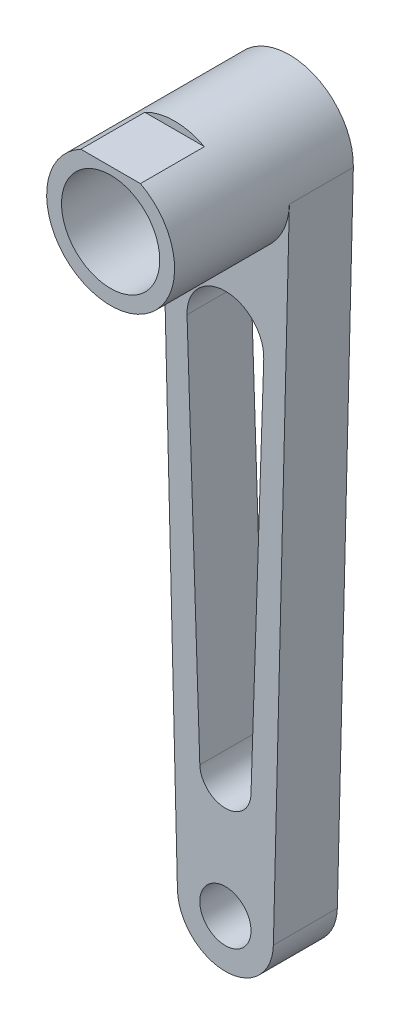
from build123d import *

# Parameters (mm, degrees)
SKETCH1_R           = 4
BOSS_EXTRUDE2_DEPTH = 10
SKETCH1_6_R         = 7.675
BOSS_EXTRUDE3_DEPTH = 27.94
SKETCH2_W           = 20.025396677
SKETCH2_H           = 9.808205023
CUT_EXTRUDE1_DEPTH  = 10


with BuildPart() as part:
    # Sketch1 → Boss-Extrude2 (new body)
    with BuildSketch(Plane.XY):
        with BuildLine():
            ThreePointArc((9.996972197, -0.246062766), (5.5e-08, -10), (-9.996972195, -0.246062876))
            Line((-9.996972195, -0.246062876), (-7.497729139, -101.784547426))
            ThreePointArc((-7.497729139, -101.784547426), (1.58e-07, -109.1), (7.497729147, -101.784547111))
            Line((7.497729147, -101.784547111), (9.996972197, -0.246062766))
        make_face()
        with BuildLine():
            Line((5.996665744, -23.199999888), (3.997777167, -83.133333141))
            ThreePointArc((3.997777167, -83.133333141), (1.93e-07, -87), (-3.997777154, -83.133333527))
            Line((-3.997777154, -83.133333527), (-5.996665745, -23.199999845))
            ThreePointArc((-5.996665745, -23.199999845), (2.1e-08, -17), (5.996665744, -23.199999888))
        make_face(mode=Mode.SUBTRACT)
        with Locations((0, -101.6)):
            Circle(SKETCH1_R, mode=Mode.SUBTRACT)
    extrude(amount=BOSS_EXTRUDE2_DEPTH)

    # Sketch1<6> → Boss-Extrude3 (add)
    with BuildSketch(Plane.XY):
        with BuildLine():
            ThreePointArc((10, 0), (-0.123040752, 9.99924302), (-9.996972195, -0.246062876))
            ThreePointArc((-9.996972195, -0.246062876), (5.5e-08, -10), (9.996972197, -0.246062766))
            ThreePointArc((9.996972197, -0.246062766), (9.999243021, -0.123040697), (10, 0))
        make_face()
        Circle(SKETCH1_6_R, mode=Mode.SUBTRACT)
    extrude(amount=BOSS_EXTRUDE3_DEPTH)

    # Sketch2 → Cut-Extrude1 (cut)
    with BuildSketch(Plane.XY.offset(27.94)):
        with Locations((-0.020605473, 13.754102512)):
            Rectangle(SKETCH2_W, SKETCH2_H)
    extrude(amount=-CUT_EXTRUDE1_DEPTH, mode=Mode.SUBTRACT)


solid = part.part
